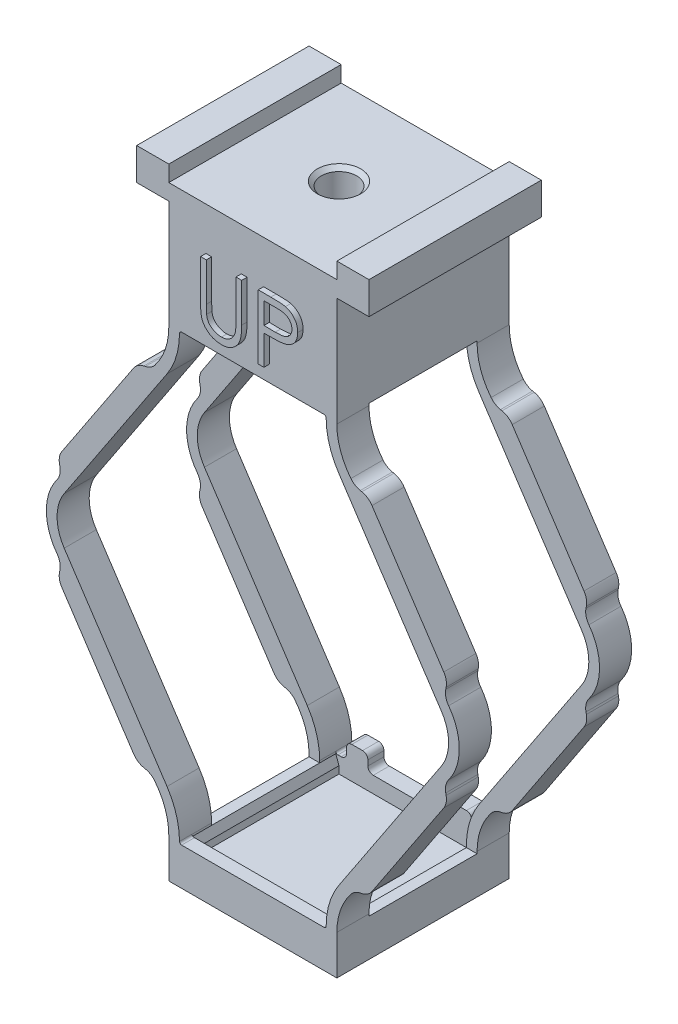
from build123d import *

# Parameters (mm, degrees)
SKIZZE1_W                        = 12.45
SKIZZE1_H                        = 12.45
AUFSATZ_LINEAR_AUSTRAGEN1_DEPTH  = 44.9
WANDUNG1_T                       = -1.2
SKIZZE2_W                        = 12.65
SKIZZE2_H                        = 12.65
AUFSATZ_LINEAR_AUSTRAGEN2_DEPTH  = 2.6
SKIZZE4_W                        = 10.05
SKIZZE4_H                        = 10.05
AUFSATZ_LINEAR_AUSTRAGEN3_DEPTH  = 2.4
SKIZZE5_W                        = 15.7
SKIZZE5_H                        = 16.1
SKIZZE5_W_2                      = 13.1
SKIZZE5_H_2                      = 13.1
AUFSATZ_LINEAR_AUSTRAGEN10_DEPTH = 1.5
SKIZZE13_W                       = 2
SKIZZE13_H                       = 1.5
AUFSATZ_LINEAR_AUSTRAGEN8_DEPTH  = 1.5
VERRUNDUNG3_R                    = 0.5
FASE1_SIZE                       = 0.3
FASE1_SIZE2                      = 0.824243226
SKIZZE8_W                        = 15.7
SKIZZE8_H                        = 16.1
AUFSATZ_LINEAR_AUSTRAGEN4_DEPTH  = 2
AUFSATZ_LINEAR_START             = -47.5
SKIZZE8_2_W                      = 15.7
SKIZZE8_2_H                      = 16.1
AUFSATZ_LINEAR_AUSTRAGEN5_DEPTH  = 10
SKIZZE9_W                        = 3
SKIZZE9_H                        = 3
AUFSATZ_LINEAR_AUSTRAGEN6_DEPTH  = 16.1
LINEAR_AUSTRAGEN_D_NN2_START     = -16.1
LINEAR_AUSTRAGEN_D_NN2_DEPTH     = 3
SKIZZE16_W                       = 3
SKIZZE16_H                       = 17.374307142
AUFSATZ_LINEAR_AUSTRAGEN9_DEPTH  = 1
FORMSCHR_GE1_ANGLE               = -45
FORMSCHR_GE3_ANGLE               = -45
VERRUNDUNG6_R                    = 1.5
VERRUNDUNG5_R                    = 0.2
AUFSATZ_LINEAR_AUSTRAGEN11_DEPTH = 0.5


# Read off the part's stored shape, not the designer's step: M4 Gewindebohrung1
with BuildPart() as part:
    # Skizze1 → Aufsatz-Linear austragen1 (new body)
    with BuildSketch(Plane(origin=(0, 0, 0), x_dir=(1, 0, 0), z_dir=(0, 1, 0))):
        Rectangle(SKIZZE1_W, SKIZZE1_H)
    extrude(amount=AUFSATZ_LINEAR_AUSTRAGEN1_DEPTH)

    # Wandung1
    wandung1_openings = [part.faces().sort_by_distance(p)[0] for p in [
        (0, 44.9, 0),
    ]]
    offset(amount=WANDUNG1_T, openings=wandung1_openings, kind=Kind.INTERSECTION)


with BuildPart() as body_2:
    # Skizze2 → Aufsatz-Linear austragen2 (new body)
    with BuildSketch(Plane(origin=(0, 44.9, 0), x_dir=(1, 0, 0), z_dir=(0, 1, 0))):
        Rectangle(SKIZZE2_W, SKIZZE2_H)
    extrude(amount=AUFSATZ_LINEAR_AUSTRAGEN2_DEPTH)

    # Skizze4 → Aufsatz-Linear austragen3 (add)
    with BuildSketch(Plane.XZ.offset(-44.9)):
        Rectangle(SKIZZE4_W, SKIZZE4_H)
    extrude(amount=AUFSATZ_LINEAR_AUSTRAGEN3_DEPTH)


with BuildPart() as body_3:
    # Skizze5 → Aufsatz-Linear austragen10 (new body)
    with BuildSketch(Plane(origin=(0, 47.5, 0), x_dir=(1, 0, 0), z_dir=(0, 1, 0))):
        Rectangle(SKIZZE5_W, SKIZZE5_H)
        Rectangle(SKIZZE5_W_2, SKIZZE5_H_2, mode=Mode.SUBTRACT)
    extrude(amount=-AUFSATZ_LINEAR_AUSTRAGEN10_DEPTH)

    # Skizze13 → Aufsatz-Linear austragen8 (add)
    with BuildSketch(Plane.XZ.offset(-46)):
        with Locations((-4.85, -7.3)):
            Rectangle(SKIZZE13_W, SKIZZE13_H)
        with Locations((4.85, -7.3)):
            Rectangle(SKIZZE13_W, SKIZZE13_H)
    extrude(amount=AUFSATZ_LINEAR_AUSTRAGEN8_DEPTH)

    # Verrundung3
    verrundung3_edges = [body_3.edges().sort_by_distance(p)[0] for p in [
        (-5.85, 46, -7.3),
        (-3.85, 46, -7.3),
        (-5.85, 44.5, -7.3),
        (-3.85, 44.5, -7.3),
        (3.85, 46, -7.3),
        (5.85, 46, -7.3),
        (3.85, 44.5, -7.3),
        (5.85, 44.5, -7.3),
    ]]
    fillet(verrundung3_edges, radius=VERRUNDUNG3_R)

    # Fase1
    fase1_edges = [body_3.edges().sort_by_distance(p)[0] for p in [
        (0, 46, 6.55),
        (-6.55, 46, 0),
        (6.55, 46, 0),
    ]]
    fase1_side = [body_3.faces().sort_by_distance(p)[0] for p in [
        (7.1, 46, -7.825122255),
    ]]
    chamfer(fase1_edges, length=FASE1_SIZE, length2=FASE1_SIZE2, reference=fase1_side[0])


with BuildPart() as body_4:
    # Spiegeln1: mirrored copy
    add(body_3.part.mirror(Plane.ZX.offset(23.75)))

    # Skizze8 → Aufsatz-Linear austragen4 (add)
    with BuildSketch(Plane.XZ):
        Rectangle(SKIZZE8_W, SKIZZE8_H)
    extrude(amount=AUFSATZ_LINEAR_AUSTRAGEN4_DEPTH)


with BuildPart() as body_3_1:
    add(body_3.part)

    # Skizze8<2> → Aufsatz-Linear austragen5 (add)
    with BuildSketch(Plane.XZ.offset(AUFSATZ_LINEAR_START)):
        Rectangle(SKIZZE8_2_W, SKIZZE8_2_H)
    extrude(amount=-AUFSATZ_LINEAR_AUSTRAGEN5_DEPTH)

    # Skizze9 → Aufsatz-Linear austragen6 (add)
    with BuildSketch(Plane.XY.offset(8.05)):
        with Locations((9.35, 57.5)):
            Rectangle(SKIZZE9_W, SKIZZE9_H)
        with Locations((-9.35, 57.5)):
            Rectangle(SKIZZE9_W, SKIZZE9_H)
    extrude(amount=-AUFSATZ_LINEAR_AUSTRAGEN6_DEPTH)


with BuildPart() as m4_gewindebohrung1_tool:
    # M4 Gewindebohrung1 outline → M4 Gewindebohrung1 (revolve)
    with BuildSketch(Plane.XY):
        Polygon((2.025, 45.85), (2.025, 47.5), (1.65, 47.875), (1.65, 57.125), (2.025, 57.5), (0, 57.5), (0, 45.85), align=None)
    revolve(axis=Axis((0, 0, 0), (0, 1, 0)))


with BuildPart() as body_2_1:
    add(body_2.part)

    # M4 Gewindebohrung1: cut by m4_gewindebohrung1_tool
    add(m4_gewindebohrung1_tool.part, mode=Mode.SUBTRACT)


with BuildPart() as body_3_2:
    add(body_3_1.part)

    # M4 Gewindebohrung1: cut by m4_gewindebohrung1_tool
    add(m4_gewindebohrung1_tool.part, mode=Mode.SUBTRACT)


with BuildPart() as body_4_1:
    # Körper-Verschieben/Kopieren2: moved
    add(body_4.part.moved(Location((0, 3, 0))))


with BuildPart() as body_5:
    # Skizze14 → Linear-Austragen-Dünn2 (new body)
    with BuildSketch(Plane.XY.offset(8.05).offset(LINEAR_AUSTRAGEN_D_NN2_START)):
        with BuildLine():
            Line((-7.85, 46), (-7.85, 45.809068067))
            ThreePointArc((-7.85, 45.809068067), (-8.105437353, 44.07701726), (-8.85, 42.492443277))
            Line((-8.85, 42.492443277), (-18.45400963, 28.013853992))
            ThreePointArc((-18.45400963, 28.013853992), (-19.287342964, 25.25), (-18.45400963, 22.486146008))
            Line((-18.45400963, 22.486146008), (-8.85, 8.007556723))
            ThreePointArc((-8.85, 8.007556723), (-8.105437353, 6.42298274), (-7.85, 4.690931933))
            Line((-7.85, 4.690931933), (-7.85, 4.5))
            Line((-7.85, 4.5), (-6.85, 4.5))
            Line((-6.85, 4.5), (-6.85, 4.690931933))
            ThreePointArc((-6.85, 4.690931933), (-7.148010246, 6.711657875), (-8.016666667, 8.560327521))
            Line((-8.016666667, 8.560327521), (-17.620676297, 23.038916806))
            ThreePointArc((-17.620676297, 23.038916806), (-18.287342964, 25.25), (-17.620676297, 27.461083194))
            Line((-17.620676297, 27.461083194), (-8.016666667, 41.939672479))
            ThreePointArc((-8.016666667, 41.939672479), (-7.148010246, 43.788342125), (-6.85, 45.809068067))
            Line((-6.85, 45.809068067), (-6.85, 46))
            Line((-6.85, 46), (-7.85, 46))
        make_face()
    extrude(amount=LINEAR_AUSTRAGEN_D_NN2_DEPTH)

    # Skizze16 → Aufsatz-Linear austragen9 (add)
    with BuildSketch(Plane(origin=(-25.719651497, 17.060486751, 0), x_dir=(0, 0, 1), z_dir=(-0.8333333333333334, 0.5527707983925668, 0))):
        with Locations((-6.55, 21.831194261)):
            Rectangle(SKIZZE16_W, SKIZZE16_H)
    aufsatz_linear_austragen9 = extrude(amount=AUFSATZ_LINEAR_AUSTRAGEN9_DEPTH)

    # Formschräge1
    formschr_ge1_faces = [body_5.faces().sort_by_distance(p)[0] for p in [
        (-18.870676297, 28.290239391, -6.55),
        (-9.266666667, 42.768828676, -6.55),
    ]]
    draft(formschr_ge1_faces, Plane(origin=(-6.095382003, 44.83611809, -5.05), x_dir=(0.5527707983925665, 0.8333333333333335, 0), z_dir=(0.8333333333333335, -0.5527707983925665, 0)), FORMSCHR_GE1_ANGLE)

    # Spiegeln7: Aufsatz-Linear austragen9 across plane
    add(aufsatz_linear_austragen9.mirror(Plane(origin=(0, 25.25, 0), x_dir=(0, 0, 1), z_dir=(0, -1, 0))))

    # Formschräge3
    formschr_ge3_faces = [body_5.faces().sort_by_distance(p)[0] for p in [
        (-9.266666667, 7.731171324, -6.55),
        (-18.870676297, 22.209760609, -6.55),
    ]]
    draft(formschr_ge3_faces, Plane(origin=(-25.21203878, 34.483326354, -5.05), x_dir=(-0.5527707983925672, 0.833333333333333, 0), z_dir=(0.833333333333333, 0.5527707983925672, 0)), FORMSCHR_GE3_ANGLE)

    # Verrundung6
    verrundung6_edges = [body_5.edges().sort_by_distance(p)[0] for p in [
        (-9.544270183, 41.630468931, -6.55),
        (-17.87752455, 28.730028187, -6.55),
        (-17.87752455, 21.769971813, -6.55),
        (-9.544270183, 8.869531069, -6.55),
        (-10.78887493, 41.378547409, -6.55),
        (-18.181801367, 30.233291457, -6.55),
        (-10.78887493, 9.121452591, -6.55),
        (-18.181801367, 20.266708543, -6.55),
    ]]
    fillet(verrundung6_edges, radius=VERRUNDUNG6_R)


with BuildPart() as body_6:
    # Spiegeln8: mirrored copy
    add(body_5.part.mirror(Plane(origin=(0, 0, 0), x_dir=(0, 0, 1), z_dir=(1, 0, 0))))


with BuildPart() as body_7:
    # Spiegeln9: mirrored copy
    add(body_5.part.mirror(Plane.XY))


with BuildPart() as body_8:
    # Spiegeln9 2: mirrored copy
    add(body_6.part.mirror(Plane.XY))


with BuildPart() as body_3_3:
    add(body_3_2.part)

    # Kombinieren1: union body 7, body 5, body 4, body 8, body 6
    add(body_7.part)
    add(body_5.part)
    add(body_4_1.part)
    add(body_8.part)
    add(body_6.part)

    # Verrundung5
    # the kernel refuses this fillet: 0.2 mm, written as the material it adds along each edge
    with BuildSketch(Plane(origin=(6.85, 46, -8.05), x_dir=(2.779393463243845e-05, -0.9999999996137485, 0), z_dir=(0, 0, 1)), Plane(origin=(-6.85, 4.5, -8.05), x_dir=(-2.779393461909947e-05, 0.9999999996137486, 0), z_dir=(0, 0, 1))) as verrundung5_piece_1:
        with BuildLine():
            CenterArc((0.199994441, -0.199999848), VERRUNDUNG5_R, 90.070568932, 89.927838593)
            Line((-5.559e-06, -0.19999429), (-0.020005559, -0.199993734))
            Line((-0.020005559, -0.199993734), (-0.02, 5.56e-07))
            Line((-0.02, 5.56e-07), (5.56e-07, 0.02))
            ThreePointArc((5.56e-07, 0.02), (0.190932488, 0.019994693), (0.199723476, 0.019999985))
            Line((0.199723476, 0.019999985), (0.199748109, 0))
        make_face()
    extrude(amount=1.5)
    with BuildSketch(Plane(origin=(6.85, 46, 8.05), x_dir=(-1, 0, 0), z_dir=(0, 0, -1))) as verrundung5_piece_2_section:
        with BuildLine():
            CenterArc((0.19999429, -0.2), VERRUNDUNG5_R, 90, 89.927838593)
            Line((-5.552e-06, -0.199748109), (-0.020005536, -0.19972292))
            ThreePointArc((-0.020005536, -0.19972292), (-0.02, -0.190931933), (-0.02, 0))
            Line((-0.02, 0), (0, 0.02))
            Line((0, 0.02), (0.19999429, 0.02))
            Line((0.19999429, 0.02), (0.19999429, 0))
        make_face()
    verrundung5_piece_2 = extrude(amount=1.2, mode=Mode.PRIVATE)
    verrundung5_piece_2 = split(verrundung5_piece_2, bisect_by=Plane(origin=(6.791620646, 45.755766001, 6.938893906), z_dir=(0, 0.3420201433256671, 0.939692620785909)), keep=Keep.TOP, mode=Mode.PRIVATE)
    add(verrundung5_piece_2)
    with BuildSketch(Plane(origin=(-6.85, 46, 8.05), x_dir=(-2.779393463243845e-05, -0.9999999996137485, 0), z_dir=(0, 0, -1))) as verrundung5_piece_3_section:
        with BuildLine():
            CenterArc((0.199994441, -0.199999848), VERRUNDUNG5_R, 90.070568932, 89.927838593)
            Line((-5.559e-06, -0.19999429), (-0.020005559, -0.199993734))
            Line((-0.020005559, -0.199993734), (-0.02, 5.56e-07))
            Line((-0.02, 5.56e-07), (5.56e-07, 0.02))
            ThreePointArc((5.56e-07, 0.02), (0.190932488, 0.019994693), (0.199723476, 0.019999985))
            Line((0.199723476, 0.019999985), (0.199748109, 0))
        make_face()
    verrundung5_piece_3 = extrude(amount=1.2, mode=Mode.PRIVATE)
    verrundung5_piece_3 = split(verrundung5_piece_3, bisect_by=Plane(origin=(-6.791620646, 45.755766001, 6.938893906), z_dir=(0, 0.3420201433256671, 0.939692620785909)), keep=Keep.TOP, mode=Mode.PRIVATE)
    add(verrundung5_piece_3)
    with BuildSketch(Plane(origin=(6.85, 4.5, -8.05), x_dir=(-1, 0, 0), z_dir=(0, 0, 1)), Plane(origin=(-6.85, 46, -8.05), x_dir=(1, 0, 0), z_dir=(0, 0, 1))) as verrundung5_piece_4:
        with BuildLine():
            CenterArc((0.19999429, -0.2), VERRUNDUNG5_R, 90, 89.927838593)
            Line((-5.552e-06, -0.199748109), (-0.020005536, -0.19972292))
            ThreePointArc((-0.020005536, -0.19972292), (-0.02, -0.190931933), (-0.02, 0))
            Line((-0.02, 0), (0, 0.02))
            Line((0, 0.02), (0.19999429, 0.02))
            Line((0.19999429, 0.02), (0.19999429, 0))
        make_face()
    extrude(amount=1.5)
    with BuildSketch(Plane(origin=(6.85, 4.5, 8.05), x_dir=(2.779393461909947e-05, 0.9999999996137486, 0), z_dir=(0, 0, -1))) as verrundung5_piece_5_section:
        with BuildLine():
            CenterArc((0.199994441, -0.199999848), VERRUNDUNG5_R, 90.070568932, 89.927838593)
            Line((-5.559e-06, -0.19999429), (-0.020005559, -0.199993734))
            Line((-0.020005559, -0.199993734), (-0.02, 5.56e-07))
            Line((-0.02, 5.56e-07), (5.56e-07, 0.02))
            ThreePointArc((5.56e-07, 0.02), (0.190932488, 0.019994693), (0.199723476, 0.019999985))
            Line((0.199723476, 0.019999985), (0.199748109, 0))
        make_face()
    verrundung5_piece_5 = extrude(amount=1.2, mode=Mode.PRIVATE)
    verrundung5_piece_5 = split(verrundung5_piece_5, bisect_by=Plane(origin=(6.791620646, 4.744233999, 6.938893906), z_dir=(0, -0.3420201433256671, 0.939692620785909)), keep=Keep.TOP, mode=Mode.PRIVATE)
    add(verrundung5_piece_5)
    with BuildSketch(Plane(origin=(-6.85, 4.5, 8.05), x_dir=(-2.779393461909947e-05, 0.9999999996137486, 0), z_dir=(0, 0, -1))) as verrundung5_piece_6_section:
        with BuildLine():
            CenterArc((0.199994441, 0.199999848), VERRUNDUNG5_R, 180.001592475, 89.927838593)
            Line((-5.559e-06, 0.19999429), (-0.020005559, 0.199993734))
            Line((-0.020005559, 0.199993734), (-0.02, -5.56e-07))
            Line((-0.02, -5.56e-07), (5.56e-07, -0.02))
            ThreePointArc((5.56e-07, -0.02), (0.190932488, -0.019994693), (0.199723476, -0.019999985))
            Line((0.199723476, -0.019999985), (0.199748109, 0))
        make_face()
    verrundung5_piece_6 = extrude(amount=1.2, mode=Mode.PRIVATE)
    verrundung5_piece_6 = split(verrundung5_piece_6, bisect_by=Plane(origin=(-6.791620646, 4.744233999, 6.938893906), z_dir=(0, -0.3420201433256671, 0.939692620785909)), keep=Keep.TOP, mode=Mode.PRIVATE)
    add(verrundung5_piece_6)

    # Skizze12 → Aufsatz-Linear austragen11 (add)
    # profile 1 of 2: a face of its own
    with BuildSketch(Plane.XY.offset(8.05)):
        with BuildLine():
            Line((1, 53.5), (2.176682692, 53.5))
            add(Edge.make_bspline(
                [(2.176682692, 53.5), (2.257615674, 53.499911035), (2.412686862, 53.499740574), (2.635055529, 53.494572438), (2.837015069, 53.487669538), (3.018130008, 53.478100578), (3.178957604, 53.466792138), (3.318770118, 53.450931499), (3.4386665, 53.434370992), (3.510506128, 53.417534295), (3.543269231, 53.409855769)],
                knots=[0, 0, 0, 0, 1.415646017, 2.712440637, 3.8905458, 4.950247383, 5.884950622, 6.709939814, 7.411656543, 8, 8, 8, 8], degree=3))
            add(Edge.make_bspline(
                [(3.543269231, 53.409855769), (3.58474386, 53.398503855), (3.666715821, 53.376067521), (3.784831895, 53.331129709), (3.897209916, 53.277845997), (4.004235445, 53.217119243), (4.104593301, 53.146343991), (4.1997808, 53.068389217), (4.288957909, 52.9814551), (4.371623152, 52.886516689), (4.447539948, 52.785167757), (4.512905119, 52.675895363), (4.567637508, 52.560538843), (4.614580259, 52.439178435), (4.648366181, 52.310795024), (4.673818009, 52.17628066), (4.689972799, 52.035649762), (4.691520048, 51.939547132), (4.692307692, 51.890625)],
                knots=[0, 0, 0, 0, 0.999701418, 1.975846123, 2.934577507, 3.890451536, 4.834027766, 5.787354733, 6.749476667, 7.726910423, 8.712836071, 9.690891519, 10.682875813, 11.679750201, 12.712814741, 13.765529915, 14.8625177, 16, 16, 16, 16], degree=3))
            add(Edge.make_bspline(
                [(4.692307692, 51.890625), (4.69158525, 51.841291668), (4.690171743, 51.744767673), (4.673206682, 51.603557179), (4.650354925, 51.468611367), (4.615217121, 51.340229452), (4.569195967, 51.219173846), (4.515209591, 51.103594591), (4.450094967, 50.99545801), (4.375275259, 50.894371523), (4.292043955, 50.800240245), (4.200753203, 50.713746312), (4.101771559, 50.635396017), (3.995413591, 50.565013714), (3.880642422, 50.50423152), (3.75919873, 50.449790426), (3.63002693, 50.404068608), (3.540639763, 50.380017074), (3.495192308, 50.367788462)],
                knots=[0, 0, 0, 0, 1.121902311, 2.195077645, 3.232258892, 4.234102512, 5.217864754, 6.176164875, 7.132989551, 8.084763148, 9.034132444, 9.988522005, 10.94243251, 11.903244335, 12.886203696, 13.894208494, 14.929344452, 16, 16, 16, 16], degree=3))
            add(Edge.make_bspline(
                [(3.495192308, 50.367788462), (3.457602592, 50.35979478), (3.375222545, 50.342276161), (3.239549307, 50.322718807), (3.081585789, 50.306025777), (2.901547594, 50.293509541), (2.699596329, 50.282794624), (2.475622745, 50.274277891), (2.229187184, 50.269598142), (2.057293623, 50.269356783), (1.967548077, 50.269230769)],
                knots=[0, 0, 0, 0, 0.601384939, 1.31797006, 2.144135048, 3.087295005, 4.142315834, 5.309527816, 6.595305764, 8, 8, 8, 8], degree=3))
            Line((1.967548077, 50.269230769), (1.538461538, 50.269230769))
            Line((1.538461538, 50.269230769), (1.538461538, 47.5))
            Line((1.538461538, 47.5), (1, 47.5))
            Line((1, 47.5), (1, 53.5))
        make_face()
        with BuildLine():
            Line((1.538461538, 52.884615385), (1.538461538, 50.884615385))
            Line((1.538461538, 50.884615385), (2.588942308, 50.871394231))
            add(Edge.make_bspline(
                [(2.588942308, 50.871394231), (2.640233609, 50.871367722), (2.739250409, 50.871316547), (2.882283935, 50.878148358), (3.01498557, 50.886034986), (3.136947699, 50.897582283), (3.248225301, 50.913904439), (3.349003922, 50.930381704), (3.438502121, 50.954219468), (3.54324361, 50.986316158), (3.65995792, 51.041057785), (3.78693086, 51.120514739), (3.89453758, 51.221795953), (3.98765466, 51.335672236), (4.061550451, 51.462356458), (4.115646437, 51.597903206), (4.147431279, 51.740922377), (4.151693325, 51.838787758), (4.153846154, 51.888221154)],
                knots=[0, 0, 0, 0, 1.160613943, 2.240541288, 3.23993089, 4.169200891, 5.011653406, 5.7853311, 6.478053781, 7.106038997, 8.262395093, 9.384106736, 10.481365981, 11.59014053, 12.70357646, 13.786202915, 14.881775077, 16, 16, 16, 16], degree=3))
            add(Edge.make_bspline(
                [(4.153846154, 51.888221154), (4.151681617, 51.936458605), (4.147378786, 52.032348689), (4.115397306, 52.172883707), (4.061655625, 52.307002058), (3.987158606, 52.432098775), (3.89674524, 52.545565297), (3.791660652, 52.6441318), (3.672152204, 52.723369005), (3.560983808, 52.774511773), (3.462238918, 52.80573796), (3.376469844, 52.827586258), (3.279628687, 52.845030154), (3.171683922, 52.859155016), (3.053472207, 52.871246664), (2.923977953, 52.879451196), (2.783691707, 52.884253693), (2.686302157, 52.884491902), (2.635817308, 52.884615385)],
                knots=[0, 0, 0, 0, 1.120700087, 2.227813068, 3.331159281, 4.466773991, 5.599788987, 6.693661531, 7.80175334, 8.91857717, 9.525282508, 10.207424825, 10.974604443, 11.810962634, 12.737642355, 13.736264703, 14.826523623, 16, 16, 16, 16], degree=3))
            Line((2.635817308, 52.884615385), (1.538461538, 52.884615385))
        make_face(mode=Mode.SUBTRACT)
    # profile 2 of 2: a face of its own
    with BuildSketch(Plane.XY.offset(8.05)):
        with BuildLine():
            Line((-4.384615385, 53.5), (-3.846153846, 53.5))
            Line((-3.846153846, 53.5), (-3.846153846, 49.905048077))
            add(Edge.make_bspline(
                [(-3.846153846, 49.905048077), (-3.846233979, 49.854166816), (-3.846386044, 49.757610854), (-3.845370306, 49.620179482), (-3.842525674, 49.497998123), (-3.840732258, 49.390595813), (-3.836742543, 49.298465389), (-3.833488749, 49.221107714), (-3.829304937, 49.158889081), (-3.824276736, 49.122578922), (-3.822115385, 49.106971154)],
                knots=[0, 0, 0, 0, 1.528628734, 2.90083645, 4.128790002, 5.200304208, 6.127813768, 6.898992206, 7.526736466, 8, 8, 8, 8], degree=3))
            add(Edge.make_bspline(
                [(-3.822115385, 49.106971154), (-3.813239741, 49.050662417), (-3.795988564, 48.941217738), (-3.752023345, 48.785374969), (-3.690621915, 48.644921041), (-3.617862413, 48.515473113), (-3.521977937, 48.40063421), (-3.407114733, 48.294842805), (-3.267952844, 48.202319712), (-3.113220378, 48.11771832), (-2.946445685, 48.049721036), (-2.776026371, 47.99830384), (-2.604524121, 47.966968583), (-2.489707838, 47.963340231), (-2.432692308, 47.961538462)],
                knots=[0, 0, 0, 0, 1.035780045, 2.013197591, 2.933192213, 3.817615948, 4.702609284, 5.640816605, 6.646850145, 7.73207398, 8.84249596, 9.914020372, 10.964143139, 12, 12, 12, 12], degree=3))
            add(Edge.make_bspline(
                [(-2.432692308, 47.961538462), (-2.383743038, 47.963379348), (-2.286127218, 47.967050488), (-2.141087623, 47.989784369), (-1.999830293, 48.030756768), (-1.861657699, 48.083624925), (-1.732141726, 48.153477938), (-1.611210111, 48.234170806), (-1.503271938, 48.328818022), (-1.404772513, 48.43356147), (-1.318998338, 48.551743984), (-1.244647809, 48.680792221), (-1.183746215, 48.822648244), (-1.153671601, 48.922341539), (-1.138221154, 48.973557692)],
                knots=[0, 0, 0, 0, 0.994687771, 1.983630487, 2.973142513, 3.978332533, 4.983357753, 5.956394766, 6.925816176, 7.893390482, 8.871859704, 9.88551698, 10.913711441, 12, 12, 12, 12], degree=3))
            add(Edge.make_bspline(
                [(-1.138221154, 48.973557692), (-1.133078082, 48.994726677), (-1.121617245, 49.041899706), (-1.110908025, 49.121650489), (-1.099753981, 49.215746542), (-1.092014719, 49.324863935), (-1.084469769, 49.448637031), (-1.07995593, 49.587710615), (-1.077869588, 49.741579691), (-1.07724785, 49.848957683), (-1.076923077, 49.905048077)],
                knots=[0, 0, 0, 0, 0.558680831, 1.244966039, 2.062412453, 2.990489873, 4.051219941, 5.244515665, 6.560634259, 8, 8, 8, 8], degree=3))
            Line((-1.076923077, 49.905048077), (-1.076923077, 53.5))
            Line((-1.076923077, 53.5), (-0.538461538, 53.5))
            Line((-0.538461538, 53.5), (-0.538461538, 49.876201923))
            add(Edge.make_bspline(
                [(-0.538461538, 49.876201923), (-0.538897173, 49.810890416), (-0.539747341, 49.68343104), (-0.547119758, 49.496657282), (-0.558874615, 49.319480742), (-0.575482766, 49.151877605), (-0.597489057, 48.994447618), (-0.621960864, 48.845810873), (-0.653125778, 48.707034314), (-0.689525894, 48.577035883), (-0.731137691, 48.453289289), (-0.785036802, 48.33584595), (-0.845764516, 48.22113555), (-0.917789635, 48.110893078), (-0.998723434, 48.004630415), (-1.090354887, 47.902992001), (-1.189653448, 47.804353636), (-1.298269836, 47.711245523), (-1.414413594, 47.625859219), (-1.537739236, 47.550777326), (-1.667299412, 47.487308268), (-1.802757343, 47.435063826), (-1.944170834, 47.395781656), (-2.09154345, 47.36650996), (-2.245210639, 47.34987745), (-2.349721478, 47.34740557), (-2.402644231, 47.346153846)],
                knots=[0, 0, 0, 0, 1.316592851, 2.569410997, 3.76748051, 4.895814652, 5.963796859, 6.97159953, 7.931736103, 8.829262218, 9.692595152, 10.560224239, 11.431080259, 12.30701507, 13.211635791, 14.121146779, 15.063487852, 16.031507147, 17.00238618, 17.966455255, 18.938106653, 19.907068911, 20.888905087, 21.893141452, 22.933117798, 24, 24, 24, 24], degree=3))
            add(Edge.make_bspline(
                [(-2.402644231, 47.346153846), (-2.460362692, 47.347499158), (-2.573606108, 47.350138655), (-2.740471366, 47.36526337), (-2.900438559, 47.393752046), (-3.055197206, 47.430026235), (-3.202640344, 47.480055499), (-3.344743391, 47.538509427), (-3.479072559, 47.610299016), (-3.607807065, 47.690173404), (-3.727506647, 47.780044212), (-3.83738791, 47.877998796), (-3.937632259, 47.982468015), (-4.026550024, 48.094582928), (-4.105614398, 48.213471568), (-4.173723335, 48.339470265), (-4.232203182, 48.472530235), (-4.262385869, 48.565021436), (-4.277644231, 48.611778846)],
                knots=[0, 0, 0, 0, 1.13879206, 2.234305948, 3.301075583, 4.341971843, 5.366689343, 6.369221514, 7.369726634, 8.367512178, 9.355451585, 10.318319045, 11.268648973, 12.207971039, 13.137398894, 14.081662264, 15.030215811, 16, 16, 16, 16], degree=3))
            add(Edge.make_bspline(
                [(-4.277644231, 48.611778846), (-4.286519359, 48.643720402), (-4.30576971, 48.713002349), (-4.326384506, 48.827664901), (-4.34371436, 48.959690474), (-4.360009603, 49.109088106), (-4.369624959, 49.275973591), (-4.378054854, 49.46027459), (-4.384674772, 49.662213953), (-4.384635734, 49.802878837), (-4.384615385, 49.876201923)],
                knots=[0, 0, 0, 0, 0.625038921, 1.35572334, 2.194682327, 3.136881307, 4.189498639, 5.346923369, 6.617055217, 8, 8, 8, 8], degree=3))
            Line((-4.384615385, 49.876201923), (-4.384615385, 53.5))
        make_face()
    extrude(amount=AUFSATZ_LINEAR_AUSTRAGEN11_DEPTH)


solid = body_3_3.part
